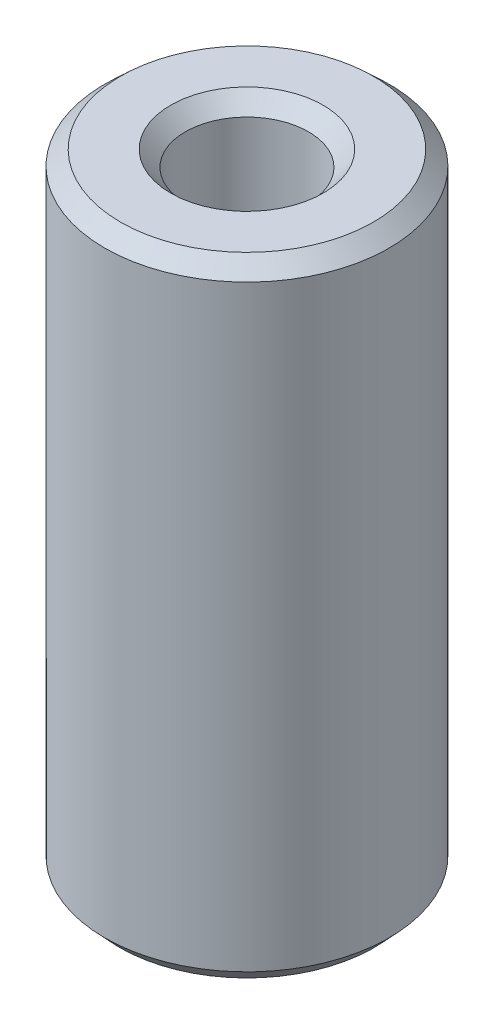
from build123d import *
from OCP.BRepFilletAPI import BRepFilletAPI_MakeChamfer

# Parameters (mm, degrees)
SKETCH1_R           = 32.5
BOSS_EXTRUDE1_DEPTH = 143.563032073
SKETCH2_R           = 14.076884793
CUT_EXTRUDE1_DEPTH  = 151.740983737
CHAMFER1_SIZE       = 3.358400979
CHAMFER1_SIZE2      = 3.58659117


with BuildPart() as part:
    # Sketch1 → Boss-Extrude1 (new body)
    with BuildSketch(Plane(origin=(0, 0, 0), x_dir=(1, 0, 0), z_dir=(0, 1, 0))):
        Circle(SKETCH1_R)
    extrude(amount=BOSS_EXTRUDE1_DEPTH)

    # Sketch2 → Cut-Extrude1 (cut, through all)
    with BuildSketch(Plane(origin=(0, 0, 0), x_dir=(1, 0, 0), z_dir=(0, 1, 0))):
        Circle(SKETCH2_R)
    extrude(amount=CUT_EXTRUDE1_DEPTH, mode=Mode.SUBTRACT)

    # Chamfer1: one chamfer whose edges measure the first distance from different faces: ONE call of the kernel's chamfer builder (chamfer() names one face for all edges)
    chamfer1_edges_1 = [part.edges().sort_by_distance(p)[0] for p in [
        (-14.076884793, 143.563032073, 0),
    ]]
    chamfer1_side_1 = [part.faces().sort_by_distance(p)[0] for p in [
        (-31.580761184, 143.563032073, 0),
    ]]
    chamfer1_edges_2 = [part.edges().sort_by_distance(p)[0] for p in [
        (-14.076884793, 0, 0),
    ]]
    chamfer1_side_2 = [part.faces().sort_by_distance(p)[0] for p in [
        (-14.076884793, 71.781516036, 0),
    ]]
    chamfer1_edges_3 = [part.edges().sort_by_distance(p)[0] for p in [
        (-32.5, 0, 0),
    ]]
    chamfer1_side_3 = [part.faces().sort_by_distance(p)[0] for p in [
        (-31.580761184, 0, 0),
    ]]
    chamfer1_edges_4 = [part.edges().sort_by_distance(p)[0] for p in [
        (-32.5, 143.563032073, 0),
    ]]
    chamfer1_side_4 = [part.faces().sort_by_distance(p)[0] for p in [
        (-32.5, 71.781516036, 0),
    ]]
    chamfer1 = BRepFilletAPI_MakeChamfer(part.part.solid().wrapped)
    for e in chamfer1_edges_1:
        chamfer1.Add(CHAMFER1_SIZE, CHAMFER1_SIZE2, e.wrapped, chamfer1_side_1[0].wrapped)  # the first distance lies on this face
    for e in chamfer1_edges_2:
        chamfer1.Add(CHAMFER1_SIZE, CHAMFER1_SIZE2, e.wrapped, chamfer1_side_2[0].wrapped)  # the first distance lies on this face
    for e in chamfer1_edges_3:
        chamfer1.Add(CHAMFER1_SIZE, CHAMFER1_SIZE2, e.wrapped, chamfer1_side_3[0].wrapped)  # the first distance lies on this face
    for e in chamfer1_edges_4:
        chamfer1.Add(CHAMFER1_SIZE, CHAMFER1_SIZE2, e.wrapped, chamfer1_side_4[0].wrapped)  # the first distance lies on this face
    add(Compound.cast(chamfer1.Shape()), mode=Mode.REPLACE)


solid = part.part
